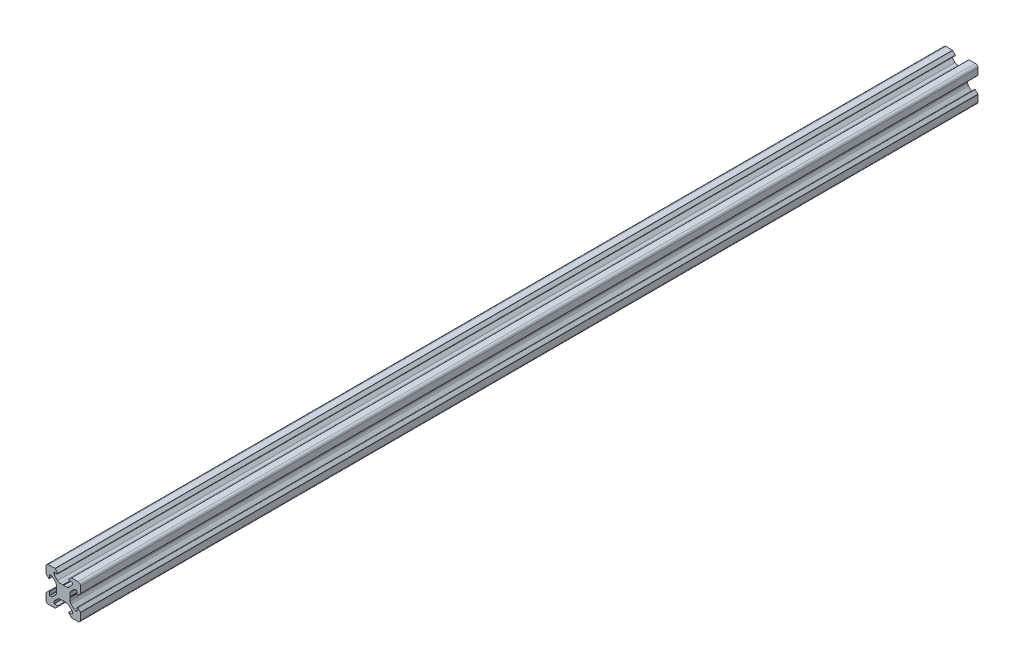
from build123d import *

# Parameters (mm, degrees)
EXTRUDE_1_DEPTH = 520


# Read off the part's stored shape, not the designer's step: 222 Конструкционный профиль 20х20-1-surface1
with BuildPart() as part:
    # Эскиз1 → Бобышка-Вытянуть1 (new body)
    with BuildSketch(Plane.XY):
        with BuildLine():
            Line((-3.945217202, 0.181521503), (-3.8, 0))
            Line((-3.8, 0), (-3.945217202, -0.181521503))
            ThreePointArc((-3.945217202, -0.181521503), (-3.98590708, -0.254943529), (-4, -0.337695265))
            Line((-4, -0.337695265), (-4, -1.898780669))
            ThreePointArc((-4, -1.898780669), (-4.152240935, -2.664147534), (-4.585786438, -3.312994231))
            Line((-4.585786438, -3.312994231), (-6.279898987, -5.007106781))
            ThreePointArc((-6.279898987, -5.007106781), (-6.604322336, -5.223879533), (-6.987005769, -5.3))
            Line((-6.987005769, -5.3), (-7.8, -5.3))
            ThreePointArc((-7.8, -5.3), (-7.941421356, -5.241421356), (-8, -5.1))
            Line((-8, -5.1), (-8, -3.33))
            ThreePointArc((-8, -3.33), (-8.154329142, -3.099030117), (-8.426776695, -3.153223305))
            Line((-8.426776695, -3.153223305), (-9.926776695, -4.653223305))
            ThreePointArc((-9.926776695, -4.653223305), (-9.980969883, -4.734329142), (-10, -4.83))
            Line((-10, -4.83), (-10, -8.5))
            ThreePointArc((-10, -8.5), (-9.560660172, -9.560660172), (-8.5, -10))
            Line((-8.5, -10), (-4.83, -10))
            ThreePointArc((-4.83, -10), (-4.734329142, -9.980969883), (-4.653223305, -9.926776695))
            Line((-4.653223305, -9.926776695), (-3.153223305, -8.426776695))
            ThreePointArc((-3.153223305, -8.426776695), (-3.099030117, -8.154329142), (-3.33, -8))
            Line((-3.33, -8), (-5.1, -8))
            ThreePointArc((-5.1, -8), (-5.241421356, -7.941421356), (-5.3, -7.8))
            Line((-5.3, -7.8), (-5.3, -6.987005769))
            ThreePointArc((-5.3, -6.987005769), (-5.223879533, -6.604322336), (-5.007106781, -6.279898987))
            Line((-5.007106781, -6.279898987), (-3.312994231, -4.585786438))
            ThreePointArc((-3.312994231, -4.585786438), (-2.664147534, -4.152240935), (-1.898780669, -4))
            Line((-1.898780669, -4), (-0.337695265, -4))
            ThreePointArc((-0.337695265, -4), (-0.254943529, -3.98590708), (-0.181521503, -3.945217202))
            Line((-0.181521503, -3.945217202), (0, -3.8))
            Line((0, -3.8), (0.181521503, -3.945217202))
            ThreePointArc((0.181521503, -3.945217202), (0.254943529, -3.98590708), (0.337695265, -4))
            Line((0.337695265, -4), (1.898780669, -4))
            ThreePointArc((1.898780669, -4), (2.664147534, -4.152240935), (3.312994231, -4.585786438))
            Line((3.312994231, -4.585786438), (5.007106781, -6.279898987))
            ThreePointArc((5.007106781, -6.279898987), (5.223879533, -6.604322336), (5.3, -6.987005769))
            Line((5.3, -6.987005769), (5.3, -7.8))
            ThreePointArc((5.3, -7.8), (5.241421356, -7.941421356), (5.1, -8))
            Line((5.1, -8), (3.33, -8))
            ThreePointArc((3.33, -8), (3.099030117, -8.154329142), (3.153223305, -8.426776695))
            Line((3.153223305, -8.426776695), (4.653223305, -9.926776695))
            ThreePointArc((4.653223305, -9.926776695), (4.734329142, -9.980969883), (4.83, -10))
            Line((4.83, -10), (8.5, -10))
            ThreePointArc((8.5, -10), (9.560660172, -9.560660172), (10, -8.5))
            Line((10, -8.5), (10, -4.83))
            ThreePointArc((10, -4.83), (9.980969883, -4.734329142), (9.926776695, -4.653223305))
            Line((9.926776695, -4.653223305), (8.426776695, -3.153223305))
            ThreePointArc((8.426776695, -3.153223305), (8.154329142, -3.099030117), (8, -3.33))
            Line((8, -3.33), (8, -5.1))
            ThreePointArc((8, -5.1), (7.941421356, -5.241421356), (7.8, -5.3))
            Line((7.8, -5.3), (6.987005769, -5.3))
            ThreePointArc((6.987005769, -5.3), (6.604322336, -5.223879533), (6.279898987, -5.007106781))
            Line((6.279898987, -5.007106781), (4.585786438, -3.312994231))
            ThreePointArc((4.585786438, -3.312994231), (4.152240935, -2.664147534), (4, -1.898780669))
            Line((4, -1.898780669), (4, -0.337695265))
            ThreePointArc((4, -0.337695265), (3.98590708, -0.254943529), (3.945217202, -0.181521503))
            Line((3.945217202, -0.181521503), (3.8, 0))
            Line((3.8, 0), (3.945217202, 0.181521503))
            ThreePointArc((3.945217202, 0.181521503), (3.98590708, 0.254943529), (4, 0.337695265))
            Line((4, 0.337695265), (4, 1.898780669))
            ThreePointArc((4, 1.898780669), (4.152240935, 2.664147534), (4.585786438, 3.312994231))
            Line((4.585786438, 3.312994231), (6.279898987, 5.007106781))
            ThreePointArc((6.279898987, 5.007106781), (6.604322336, 5.223879533), (6.987005769, 5.3))
            Line((6.987005769, 5.3), (7.8, 5.3))
            ThreePointArc((7.8, 5.3), (7.941421356, 5.241421356), (8, 5.1))
            Line((8, 5.1), (8, 3.33))
            ThreePointArc((8, 3.33), (8.154329142, 3.099030117), (8.426776695, 3.153223305))
            Line((8.426776695, 3.153223305), (9.926776695, 4.653223305))
            ThreePointArc((9.926776695, 4.653223305), (9.980969883, 4.734329142), (10, 4.83))
            Line((10, 4.83), (10, 8.5))
            ThreePointArc((10, 8.5), (9.560660172, 9.560660172), (8.5, 10))
            Line((8.5, 10), (4.83, 10))
            ThreePointArc((4.83, 10), (4.734329142, 9.980969883), (4.653223305, 9.926776695))
            Line((4.653223305, 9.926776695), (3.153223305, 8.426776695))
            ThreePointArc((3.153223305, 8.426776695), (3.099030117, 8.154329142), (3.33, 8))
            Line((3.33, 8), (5.1, 8))
            ThreePointArc((5.1, 8), (5.241421356, 7.941421356), (5.3, 7.8))
            Line((5.3, 7.8), (5.3, 6.987005769))
            ThreePointArc((5.3, 6.987005769), (5.223879533, 6.604322336), (5.007106781, 6.279898987))
            Line((5.007106781, 6.279898987), (3.312994231, 4.585786438))
            ThreePointArc((3.312994231, 4.585786438), (2.664147534, 4.152240935), (1.898780669, 4))
            Line((1.898780669, 4), (0.337695265, 4))
            ThreePointArc((0.337695265, 4), (0.254943529, 3.98590708), (0.181521503, 3.945217202))
            Line((0.181521503, 3.945217202), (0, 3.8))
            Line((0, 3.8), (-0.181521503, 3.945217202))
            ThreePointArc((-0.181521503, 3.945217202), (-0.254943529, 3.98590708), (-0.337695265, 4))
            Line((-0.337695265, 4), (-1.898780669, 4))
            ThreePointArc((-1.898780669, 4), (-2.664147534, 4.152240935), (-3.312994231, 4.585786438))
            Line((-3.312994231, 4.585786438), (-5.007106781, 6.279898987))
            ThreePointArc((-5.007106781, 6.279898987), (-5.223879533, 6.604322336), (-5.3, 6.987005769))
            Line((-5.3, 6.987005769), (-5.3, 7.8))
            ThreePointArc((-5.3, 7.8), (-5.241421356, 7.941421356), (-5.1, 8))
            Line((-5.1, 8), (-3.33, 8))
            ThreePointArc((-3.33, 8), (-3.099030117, 8.154329142), (-3.153223305, 8.426776695))
            Line((-3.153223305, 8.426776695), (-4.653223305, 9.926776695))
            ThreePointArc((-4.653223305, 9.926776695), (-4.734329142, 9.980969883), (-4.83, 10))
            Line((-4.83, 10), (-8.5, 10))
            ThreePointArc((-8.5, 10), (-9.560660172, 9.560660172), (-10, 8.5))
            Line((-10, 8.5), (-10, 4.83))
            ThreePointArc((-10, 4.83), (-9.980969883, 4.734329142), (-9.926776695, 4.653223305))
            Line((-9.926776695, 4.653223305), (-8.426776695, 3.153223305))
            ThreePointArc((-8.426776695, 3.153223305), (-8.154329142, 3.099030117), (-8, 3.33))
            Line((-8, 3.33), (-8, 5.1))
            ThreePointArc((-8, 5.1), (-7.941421356, 5.241421356), (-7.8, 5.3))
            Line((-7.8, 5.3), (-6.987005769, 5.3))
            ThreePointArc((-6.987005769, 5.3), (-6.604322336, 5.223879533), (-6.279898987, 5.007106781))
            Line((-6.279898987, 5.007106781), (-4.585786438, 3.312994231))
            ThreePointArc((-4.585786438, 3.312994231), (-4.152240935, 2.664147534), (-4, 1.898780669))
            Line((-4, 1.898780669), (-4, 0.337695265))
            ThreePointArc((-4, 0.337695265), (-3.98590708, 0.254943529), (-3.945217202, 0.181521503))
        make_face()
    extrude(amount=EXTRUDE_1_DEPTH)


solid = part.part
